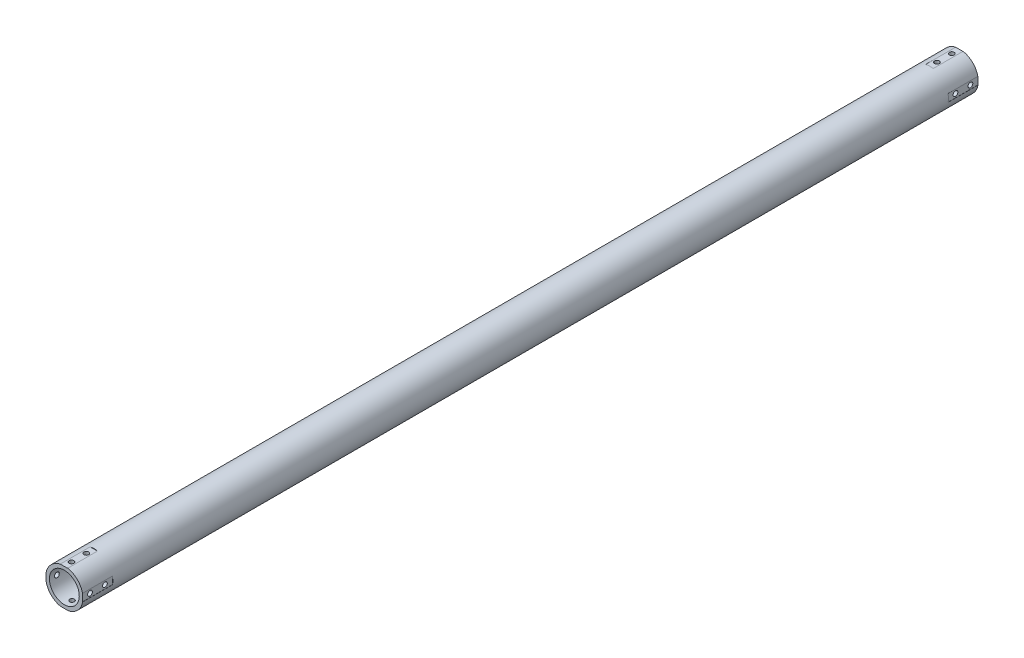
from build123d import *

# Parameters (mm, degrees)
SKETCH1_R                   = 15.875
BOSS_EXTRUDE1_DEPTH         = 381
CUT_EXTRUDE1_REACH          = 764.331
SKETCH2_R                   = 12.7
SKETCH3_W                   = 6.35
SKETCH3_H                   = 1.43871665
CUT_EXTRUDE2_DEPTH          = 25.4
F_10_32_TAPPED_HOLE1_REACH  = 384.619
F_10_32_TAPPED_HOLE1_BORE_R = 2.0193
CIRPATTERN2_START           = -15.875
CIRPATTERN2_DEPTH           = 31.75
CIRPATTERN2_2_OUTLINE_W     = 6.885848597
CIRPATTERN2_2_OUTLINE_H     = 25.4
CIRPATTERN2_2_DEPTH         = 0.382573461
CIRPATTERN2_START_2         = 15.492426539
CIRPATTERN2_3_OUTLINE_W     = 6.885848597
CIRPATTERN2_3_OUTLINE_H     = 25.4
CIRPATTERN2_3_DEPTH         = 0.382573461
CIRPATTERN2_START_3         = -12.701
CIRPATTERN2_4_DEPTH         = 28.193426539
CIRPATTERN2_START_4         = -15.492426539
CIRPATTERN2_5_DEPTH         = 3.003989814
CIRPATTERN2_6_OUTLINE_R     = 2.0193
CIRPATTERN2_6_DEPTH         = 28.576
CIRPATTERN2_7_OUTLINE_W     = 6.885848597
CIRPATTERN2_7_OUTLINE_H     = 25.4
CIRPATTERN2_7_OUTLINE_R     = 2.0193
CIRPATTERN2_7_DEPTH         = 0.382573461


# Read off the part's stored shape, not the designer's step: CirPattern2
with BuildPart() as part:
    # Sketch1 → Boss-Extrude1 (new, symmetric)
    with BuildSketch(Plane.XY):
        Circle(SKETCH1_R)
    extrude(amount=BOSS_EXTRUDE1_DEPTH, both=True)

    # Sketch2 → Cut-Extrude1 (cut, up to next)
    with BuildSketch(Plane.XY.offset(381), mode=Mode.PRIVATE) as cut_extrude1_sk1:
        Circle(SKETCH2_R)
    cut_extrude1_tool1 = extrude(cut_extrude1_sk1.sketch, amount=-CUT_EXTRUDE1_REACH, mode=Mode.PRIVATE) & part.part
    add(cut_extrude1_tool1.solids().sort_by_distance((0, 0, 381))[0], mode=Mode.SUBTRACT)

    # Sketch3 → Cut-Extrude2 (cut)
    with BuildSketch(Plane.XY.offset(381)):
        with Locations((-0.289151403, 16.211784864)):
            Rectangle(SKETCH3_W, SKETCH3_H)
    cut_extrude2 = extrude(amount=-CUT_EXTRUDE2_DEPTH, mode=Mode.SUBTRACT)

    # #10-32 Tapped Hole1 bore → #10-32 Tapped Hole1 (cut, up to next)
    with BuildSketch(Plane(origin=(0, 15.492426539, 0), x_dir=(1, 0, 0), z_dir=(0, 1, 0)), mode=Mode.PRIVATE) as f_10_32_tapped_hole1_sk1:
        with Locations((-0.289151403, -374.65)):
            Circle(F_10_32_TAPPED_HOLE1_BORE_R)
    f_10_32_tapped_hole1_tool1 = extrude(f_10_32_tapped_hole1_sk1.sketch, amount=-F_10_32_TAPPED_HOLE1_REACH, mode=Mode.PRIVATE) & part.part
    # #10-32 Tapped Hole1 bore → #10-32 Tapped Hole1 (cut, up to next)
    with BuildSketch(Plane(origin=(0, 15.492426539, 0), x_dir=(1, 0, 0), z_dir=(0, 1, 0)), mode=Mode.PRIVATE) as f_10_32_tapped_hole1_sk2:
        with Locations((-0.289151403, -361.95)):
            Circle(F_10_32_TAPPED_HOLE1_BORE_R)
    f_10_32_tapped_hole1_tool2 = extrude(f_10_32_tapped_hole1_sk2.sketch, amount=-F_10_32_TAPPED_HOLE1_REACH, mode=Mode.PRIVATE) & part.part
    f_10_32_tapped_hole1_1 = f_10_32_tapped_hole1_tool1.solids().sort_by_distance((-0.289151, 15.492427, 374.65))[0]
    add(f_10_32_tapped_hole1_1, mode=Mode.SUBTRACT)
    f_10_32_tapped_hole1_2 = f_10_32_tapped_hole1_tool2.solids().sort_by_distance((-0.289151, 15.492427, 361.95))[0]
    add(f_10_32_tapped_hole1_2, mode=Mode.SUBTRACT)
    f_10_32_tapped_hole1 = f_10_32_tapped_hole1_1 + f_10_32_tapped_hole1_2  # #10-32 Tapped Hole1 as one shape, for the pattern or mirror that repeats it

    # CirPattern2 outline → CirPattern2 (cut)
    with BuildSketch(Plane.YZ.offset(CIRPATTERN2_START)):
        with BuildLine():
            ThreePointArc((0, 363.948490419), (-1.730148597, 361.95), (0, 359.951509581))
            ThreePointArc((0, 359.951509581), (1.730148597, 361.95), (0, 363.948490419))
        make_face()
        with BuildLine():
            ThreePointArc((0, 376.648490419), (-1.730148597, 374.65), (0, 372.651509581))
            ThreePointArc((0, 372.651509581), (1.730148597, 374.65), (0, 376.648490419))
        make_face()
    cirpattern2 = extrude(amount=CIRPATTERN2_DEPTH, mode=Mode.SUBTRACT)

    # CirPattern2 2 outline → CirPattern2 2 (cut)
    with BuildSketch(Plane.YZ.offset(CIRPATTERN2_START)):
        with Locations((-0.557075701, 368.3)):
            Rectangle(CIRPATTERN2_2_OUTLINE_W, CIRPATTERN2_2_OUTLINE_H)
        with BuildLine():
            ThreePointArc((0, 359.951509581), (-1.730148597, 361.95), (0, 363.948490419))
            ThreePointArc((0, 363.948490419), (1.730148597, 361.95), (0, 359.951509581))
        make_face(mode=Mode.SUBTRACT)
        with BuildLine():
            ThreePointArc((0, 372.651509581), (-1.730148597, 374.65), (0, 376.648490419))
            ThreePointArc((0, 376.648490419), (1.730148597, 374.65), (0, 372.651509581))
        make_face(mode=Mode.SUBTRACT)
    cirpattern2_2 = extrude(amount=CIRPATTERN2_2_DEPTH, mode=Mode.SUBTRACT)

    # CirPattern2 3 outline → CirPattern2 3 (cut)
    with BuildSketch(Plane.YZ.offset(CIRPATTERN2_START_2)):
        with Locations((0.557075701, 368.3)):
            Rectangle(CIRPATTERN2_3_OUTLINE_W, CIRPATTERN2_3_OUTLINE_H)
        with BuildLine():
            ThreePointArc((0, 359.951509581), (-1.730148597, 361.95), (0, 363.948490419))
            ThreePointArc((0, 363.948490419), (1.730148597, 361.95), (0, 359.951509581))
        make_face(mode=Mode.SUBTRACT)
        with BuildLine():
            ThreePointArc((0, 372.651509581), (-1.730148597, 374.65), (0, 376.648490419))
            ThreePointArc((0, 376.648490419), (1.730148597, 374.65), (0, 372.651509581))
        make_face(mode=Mode.SUBTRACT)
    cirpattern2_3 = extrude(amount=CIRPATTERN2_3_DEPTH, mode=Mode.SUBTRACT)

    # CirPattern2 4 outline → CirPattern2 4 (cut)
    with BuildSketch(Plane.YZ.offset(CIRPATTERN2_START_3)):
        with BuildLine():
            ThreePointArc((0, 363.948490419), (1.730148597, 361.95), (0, 359.951509581))
            ThreePointArc((0, 359.951509581), (2.308451403, 361.95), (0, 363.948490419))
        make_face()
        with BuildLine():
            ThreePointArc((0, 376.648490419), (1.730148597, 374.65), (0, 372.651509581))
            ThreePointArc((0, 372.651509581), (2.308451403, 374.65), (0, 376.648490419))
        make_face()
    cirpattern2_4 = extrude(amount=CIRPATTERN2_4_DEPTH, mode=Mode.SUBTRACT)

    # CirPattern2 5 outline → CirPattern2 5 (cut)
    with BuildSketch(Plane.YZ.offset(CIRPATTERN2_START_4)):
        with BuildLine():
            ThreePointArc((0, 359.951509581), (-1.730148597, 361.95), (0, 363.948490419))
            ThreePointArc((0, 363.948490419), (-2.308451403, 361.95), (0, 359.951509581))
        make_face()
        with BuildLine():
            ThreePointArc((0, 372.651509581), (-1.730148597, 374.65), (0, 376.648490419))
            ThreePointArc((0, 376.648490419), (-2.308451403, 374.65), (0, 372.651509581))
        make_face()
    cirpattern2_5 = extrude(amount=CIRPATTERN2_5_DEPTH, mode=Mode.SUBTRACT)

    # CirPattern2 6 outline → CirPattern2 6 (cut)
    with BuildSketch(Plane(origin=(0, 0, 0), x_dir=(1, 0, 0), z_dir=(0, 1, 0)).offset(CIRPATTERN2_START)):
        with Locations((0.289151403, -361.95)):
            Circle(CIRPATTERN2_6_OUTLINE_R)
        with Locations((0.289151403, -374.65)):
            Circle(CIRPATTERN2_6_OUTLINE_R)
    cirpattern2_6 = extrude(amount=CIRPATTERN2_6_DEPTH, mode=Mode.SUBTRACT)

    # CirPattern2 7 outline → CirPattern2 7 (cut)
    with BuildSketch(Plane(origin=(0, 0, 0), x_dir=(1, 0, 0), z_dir=(0, 1, 0)).offset(CIRPATTERN2_START)):
        with Locations((0.557075701, -368.3)):
            Rectangle(CIRPATTERN2_7_OUTLINE_W, CIRPATTERN2_7_OUTLINE_H)
        with Locations((0.289151403, -374.65)):
            Circle(CIRPATTERN2_7_OUTLINE_R, mode=Mode.SUBTRACT)
        with Locations((0.289151403, -361.95)):
            Circle(CIRPATTERN2_7_OUTLINE_R, mode=Mode.SUBTRACT)
    cirpattern2_7 = extrude(amount=CIRPATTERN2_7_DEPTH, mode=Mode.SUBTRACT)

    # Mirror1: Cut-Extrude2, #10-32 Tapped Hole1, CirPattern2, CirPattern2 2, CirPattern2 3, CirPattern2 4, CirPattern2 5, CirPattern2 6, CirPattern2 7 across plane
    add(cut_extrude2.mirror(Plane.XY), mode=Mode.SUBTRACT)
    add(f_10_32_tapped_hole1.mirror(Plane.XY), mode=Mode.SUBTRACT)
    add(cirpattern2.mirror(Plane.XY), mode=Mode.SUBTRACT)
    add(cirpattern2_2.mirror(Plane.XY), mode=Mode.SUBTRACT)
    add(cirpattern2_3.mirror(Plane.XY), mode=Mode.SUBTRACT)
    add(cirpattern2_4.mirror(Plane.XY), mode=Mode.SUBTRACT)
    add(cirpattern2_5.mirror(Plane.XY), mode=Mode.SUBTRACT)
    add(cirpattern2_6.mirror(Plane.XY), mode=Mode.SUBTRACT)
    add(cirpattern2_7.mirror(Plane.XY), mode=Mode.SUBTRACT)


solid = part.part
